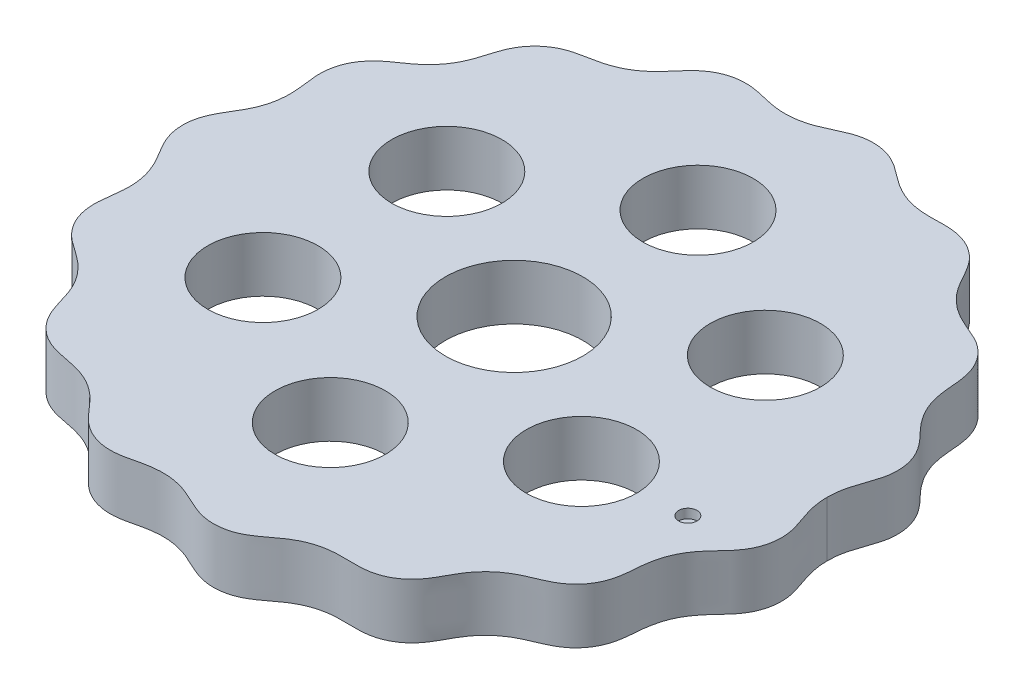
from build123d import *

# Parameters (mm, degrees)
BOSS_EXTRUDE1_DEPTH = 6
SKETCH4_R           = 7.475
SKETCH4_R_2         = 6
CUT_EXTRUDE1_DEPTH  = 52.453967101
SKETCH5_R           = 1
CUT_EXTRUDE2_DEPTH  = 1


# Read off the part's stored shape, not the designer's step: Boss-Extrude1
with BuildPart() as part:
    # Boss-Extrude1 outline → Boss-Extrude1 (new body)
    with BuildSketch(Plane(origin=(0, 0, 0), x_dir=(1, 0, 0), z_dir=(0, 1, 0))):
        with BuildLine():
            add(Edge.make_bspline(
                [(35.05, 0), (35.05, 0.594198712), (35.191346512, 1.787119828), (35.774573788, 3.479633265), (36.370656393, 5.193307382), (36.439574506, 7.030295887), (35.925490495, 8.79622364), (34.876295144, 10.295275654), (33.585470062, 11.549316205), (32.487706663, 12.969248766), (31.742957144, 14.606988848), (31.396565397, 16.368457148), (31.326535289, 18.165589032), (30.95261129, 19.954463161), (30.017730934, 21.538471981), (28.632110729, 22.747490259), (26.968497206, 23.475804895), (24.757057662, 24.380387794), (22.911251771, 25.983589547), (21.734896935, 28.063477736), (20.879346019, 29.660513957), (19.589334554, 30.969735845), (17.95061886, 31.804064637), (16.138162859, 32.06669982), (14.340381143, 31.948143856), (12.549747042, 32.056592443), (10.825868458, 32.571684344), (9.270456611, 33.470271575), (7.887358387, 34.616091716), (6.327923269, 35.566471435), (4.533281987, 35.96990507), (2.70292921, 35.78952335), (1.035797595, 35.063699847), (-0.572152539, 34.273651103), (-2.313154203, 33.82213675), (-4.112230724, 33.789925988), (-5.866279551, 34.152011292), (-7.619077132, 34.603765566), (-9.455361714, 34.561863227), (-11.185634397, 33.938560874), (-12.620076924, 32.797434213), (-13.740202432, 31.383739916), (-15.000377212, 30.10818058), (-16.521643713, 29.147509603), (-18.222513756, 28.567155407), (-19.996356323, 28.29831819), (-22.342794246, 27.65042603), (-24.201171408, 25.896958922), (-25.005623957, 23.605348695), (-25.480441092, 21.877479041), (-26.284970675, 20.269271474), (-27.44342461, 18.892648679), (-28.872607627, 17.811880308), (-30.387945124, 16.825917609), (-31.615542716, 15.461139334), (-32.345791834, 13.773450902), (-32.497916201, 11.945393512), (-32.20498318, 10.163517983), (-32.075775497, 8.375827667), (-32.351741871, 6.597861172), (-33.033589236, 4.934690781), (-34.012035472, 3.431229806), (-34.855336803, 1.817850793), (-35.05, 0.601878761), (-35.05, 0)],
                knots=[0.072369566, 0.072369566, 0.072369566, 0.072369566, 0.085664924, 0.098960282, 0.112255641, 0.125550999, 0.138846357, 0.152141715, 0.165437073, 0.178732431, 0.192027789, 0.205323147, 0.218618505, 0.231913863, 0.245209221, 0.25850458, 0.271799938, 0.285095296, 0.311686012, 0.32498137, 0.338276728, 0.351572086, 0.364867444, 0.378162802, 0.39145816, 0.404753519, 0.418048877, 0.431344235, 0.444639593, 0.457934951, 0.471230309, 0.484525667, 0.497821025, 0.511116383, 0.524411741, 0.5377071, 0.551002458, 0.564297816, 0.577593174, 0.590888532, 0.60418389, 0.617479248, 0.630774606, 0.644069964, 0.657365322, 0.67066068, 0.683956039, 0.710546755, 0.723842113, 0.737137471, 0.750432829, 0.763728187, 0.777023545, 0.790318903, 0.803614261, 0.816909619, 0.830204978, 0.843500336, 0.856795694, 0.870091052, 0.88338641, 0.896681768, 0.909977126, 0.923272484, 0.923272484, 0.923272484, 0.923272484], degree=3))
            add(Edge.make_bspline(
                [(-35.05, 0), (-35.05, -0.601878761), (-34.855336803, -1.817850793), (-34.012035472, -3.431229806), (-33.033589236, -4.934690781), (-32.351741871, -6.597861172), (-32.075775497, -8.375827667), (-32.20498318, -10.163517983), (-32.497916201, -11.945393512), (-32.345791834, -13.773450902), (-31.615542716, -15.461139334), (-30.387945124, -16.825917609), (-28.872607627, -17.811880308), (-27.443424609, -18.892648678), (-26.284970675, -20.269271474), (-25.480441092, -21.877479041), (-25.005623956, -23.605348695), (-24.201171408, -25.896958922), (-22.342794246, -27.65042603), (-19.996356323, -28.29831819), (-18.222513756, -28.567155407), (-16.521643713, -29.147509603), (-15.000377212, -30.10818058), (-13.740202432, -31.383739915), (-12.620076923, -32.797434213), (-11.185634397, -33.938560873), (-9.455361714, -34.561863227), (-7.619077132, -34.603765566), (-5.866279551, -34.152011291), (-4.112230724, -33.789925987), (-2.313154203, -33.82213675), (-0.572152539, -34.273651103), (1.035797596, -35.063699847), (2.70292921, -35.789523349), (4.533281987, -35.96990507), (6.327923269, -35.566471434), (7.887358388, -34.616091716), (9.270456611, -33.470271575), (10.825868458, -32.571684343), (12.549747043, -32.056592443), (14.340381144, -31.948143855), (16.13816286, -32.066699819), (17.95061886, -31.804064636), (19.589334554, -30.969735845), (20.879346019, -29.660513956), (21.734896935, -28.063477736), (22.911251771, -25.983589546), (24.757057662, -24.380387793), (26.968497206, -23.475804894), (28.63211073, -22.747490259), (30.017730934, -21.53847198), (30.95261129, -19.95446316), (31.326535289, -18.165589031), (31.396565397, -16.368457147), (31.742957144, -14.606988847), (32.487706663, -12.969248765), (33.585470062, -11.549316204), (34.876295144, -10.295275653), (35.925490495, -8.79622364), (36.439574506, -7.030295887), (36.370656393, -5.193307381), (35.774573788, -3.479633265), (35.191346512, -1.787119827), (35.05, -0.594198712), (35.05, 0)],
                knots=[0.072369566, 0.072369566, 0.072369566, 0.072369566, 0.085664924, 0.098960282, 0.112255641, 0.125550999, 0.138846357, 0.152141715, 0.165437073, 0.178732431, 0.192027789, 0.205323147, 0.218618505, 0.231913863, 0.245209221, 0.25850458, 0.271799938, 0.285095296, 0.311686012, 0.32498137, 0.338276728, 0.351572086, 0.364867444, 0.378162802, 0.39145816, 0.404753519, 0.418048877, 0.431344235, 0.444639593, 0.457934951, 0.471230309, 0.484525667, 0.497821025, 0.511116383, 0.524411741, 0.5377071, 0.551002458, 0.564297816, 0.577593174, 0.590888532, 0.60418389, 0.617479248, 0.630774606, 0.644069964, 0.657365322, 0.67066068, 0.683956039, 0.710546755, 0.723842113, 0.737137471, 0.750432829, 0.763728187, 0.777023545, 0.790318903, 0.803614261, 0.816909619, 0.830204978, 0.843500336, 0.856795694, 0.870091052, 0.88338641, 0.896681768, 0.909977126, 0.923272484, 0.923272484, 0.923272484, 0.923272484], degree=3))
        make_face()
    extrude(amount=BOSS_EXTRUDE1_DEPTH)

    # Sketch4 → Cut-Extrude1 (cut, through all)
    with BuildSketch(Plane(origin=(0, 6, 0), x_dir=(1, 0, 0), z_dir=(0, 1, 0))):
        with Locations(Location((1, 0, 0), (0, 0, 270))):
            Circle(SKETCH4_R)
        with Locations(Location((1, 20, 0), (0, 0, 270))):
            Circle(SKETCH4_R_2)
        with Locations(Location((18.320508076, 10, 0), (0, 0, 270))):
            Circle(SKETCH4_R_2)
        with Locations(Location((18.320508076, -10, 0), (0, 0, 270))):
            Circle(SKETCH4_R_2)
        with Locations(Location((1, -20, 0), (0, 0, 270))):
            Circle(SKETCH4_R_2)
        with Locations(Location((-16.320508076, -10, 0), (0, 0, 270))):
            Circle(SKETCH4_R_2)
        with Locations(Location((-16.320508076, 10, 0), (0, 0, 270))):
            Circle(SKETCH4_R_2)
    extrude(amount=-CUT_EXTRUDE1_DEPTH, mode=Mode.SUBTRACT)

    # Sketch5 → Cut-Extrude2 (cut)
    with BuildSketch(Plane(origin=(0, 6, 0), x_dir=(1, 0, 0), z_dir=(0, 1, 0))):
        with Locations(Location((29.220004893, -9.327172971, 0), (0, 0, 270))):
            Circle(SKETCH5_R)
    extrude(amount=-CUT_EXTRUDE2_DEPTH, mode=Mode.SUBTRACT)


solid = part.part
